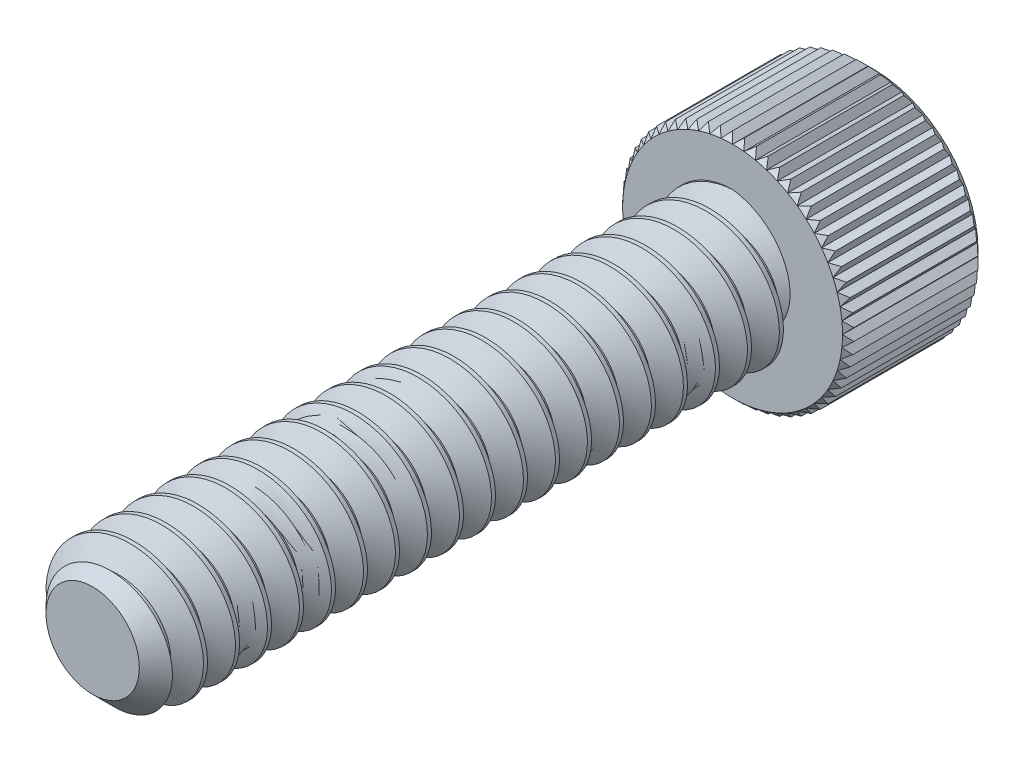
from build123d import *
from build123d.topology import SkipClean

# Parameters (mm, degrees)
SKETCH1_R          = 1.7526
EXTRUDE1_DEPTH     = 15.875
CHAMFER3_SIZE      = 0.5953125
CUT_SWEEP1_PITCH   = 0.79375
SKETCH6_R          = 2.8702
EXTRUDE2_DEPTH     = 3.5052
CUT_EXTRUDE1_DEPTH = 2.08359375
CHAMFER1_SIZE      = 0.28702
CHAMFER2_SIZE      = 0.14351
CUT_EXTRUDE3_DEPTH = 17.385717081
CIRPATTERN1_COUNT  = 60


with BuildPart() as part:
    # Sketch1 → Extrude1 (new body)
    with BuildSketch(Plane.XY):
        Circle(SKETCH1_R)
    extrude(amount=-EXTRUDE1_DEPTH)

    # Chamfer3
    chamfer3_edges = [part.edges().sort_by_distance(p)[0] for p in [
        (-1.7526, 0, 0),
    ]]
    chamfer(chamfer3_edges, length=CHAMFER3_SIZE)

    # Cut-Sweep1: the profile of Sketch3 profile screwed along a right-hand helix of 21 turns, 6 arcs to a turn; built about Z, then put on its axis
    cut_sweep1_z = Axis((0, 0, 0), (0, 0, 1))
    cut_sweep1_corners = [(1.7529, 0, -0.694704455), (1.237044252, 0, -0.396875), (1.237044252, 0, -0.29765625), (1.7529, 0, 0.000173205)]
    with BuildLine(mode=Mode.PRIVATE) as cut_sweep1_profile:
        Line(cut_sweep1_corners[0], cut_sweep1_corners[1])
        Line(cut_sweep1_corners[1], cut_sweep1_corners[2])
        Line(cut_sweep1_corners[2], cut_sweep1_corners[3])
        Line(cut_sweep1_corners[3], cut_sweep1_corners[0])
    cut_sweep1_cap = Face(cut_sweep1_profile.wire())
    cut_sweep1_turn_angles = [0, 30, 60, 90, 120, 150, 180, 210, 240, 270, 300, 330, 360]
    cut_sweep1_turn_weights = [1, 0.8660254037844387, 1, 0.8660254037844387, 1, 0.8660254037844387, 1, 0.8660254037844387, 1, 0.8660254037844387, 1, 0.8660254037844387, 1]
    cut_sweep1_turn_rails = [Edge.make_bspline([Vector(p[0], p[1], 0).rotate(cut_sweep1_z, cut_sweep1_turn_angles[k]) / cut_sweep1_turn_weights[k] + Vector(0, 0, p[2] + CUT_SWEEP1_PITCH * cut_sweep1_turn_angles[k] / 360) for k in range(13)], [0, 0, 0, 1, 1, 2, 2, 3, 3, 4, 4, 5, 5, 6, 6, 6], 2, cut_sweep1_turn_weights) for p in cut_sweep1_corners]
    cut_sweep1_turn_sides = [Face.make_surface_from_curves(cut_sweep1_turn_rails[p[0]], cut_sweep1_turn_rails[p[1]]) for p in [(0, 1), (1, 2), (2, 3), (3, 0)]]
    cut_sweep1 = Plane(origin=(0, 0, 0), x_dir=(0, 1, 0), z_dir=(0, 0, -1)) * Solid(Shell([*[p.moved(Location((0, 0, CUT_SWEEP1_PITCH * i))) for i in range(21) for p in cut_sweep1_turn_sides], cut_sweep1_cap, cut_sweep1_cap.rotate(cut_sweep1_z, 7560).moved(Location((0, 0, CUT_SWEEP1_PITCH * 7560 / 360)))]))
    add(cut_sweep1, mode=Mode.SUBTRACT)

    # Sketch6 → Extrude2 (add)
    with BuildSketch(Plane(origin=(0, 0, -15.875), x_dir=(-1, 0, 0), z_dir=(0, 0, -1))):
        Circle(SKETCH6_R)
    extrude(amount=EXTRUDE2_DEPTH)

    # Sketch7 → Cut-Extrude1 (cut)
    with BuildSketch(Plane(origin=(0, 0, -19.3802), x_dir=(-1, 0, 0), z_dir=(0, 0, -1))):
        Polygon((0, 1.603951217), (-1.3890625, 0.801975608), (-1.3890625, -0.801975608), (0, -1.603951217), (1.3890625, -0.801975608), (1.3890625, 0.801975608), align=None)
    extrude(amount=-CUT_EXTRUDE1_DEPTH, mode=Mode.SUBTRACT)

    # Cut-Extrude2 cone 1 section (through the dimple's axis) → Cut-Extrude2 (revolve, cut)
    with BuildSketch(Plane(origin=(0, 0, -19.3802), x_dir=(0, 1, 0), z_dir=(1, 0, 0))):
        Polygon((0, 0), (1.603951217, 0), (0, 1.603951217), align=None)
    revolve(axis=Axis((0, 0, -19.3802), (0, 0, 1)), mode=Mode.SUBTRACT)

    # Chamfer1
    chamfer1_edges = [part.edges().sort_by_distance(p)[0] for p in [
        (2.8702, 0, -19.3802),
    ]]
    chamfer(chamfer1_edges, length=CHAMFER1_SIZE)

    # Chamfer2
    chamfer2_edges = [part.edges().sort_by_distance(p)[0] for p in [
        (2.8702, 0, -15.875),
    ]]
    chamfer(chamfer2_edges, length=CHAMFER2_SIZE)

    # Sketch10 → Cut-Extrude3 (cut, through all)
    with SkipClean():  # the faces are left unmerged after this step: merging them gives an invalid solid
        with BuildSketch(Plane.XY.offset(-15.875)):
            Polygon((-0.308895946, 3.01371), (0, 2.72669), (0.308895946, 3.01371), align=None)
        cut_extrude3 = extrude(amount=-CUT_EXTRUDE3_DEPTH, mode=Mode.SUBTRACT)

    # CirPattern1: Cut-Extrude3 ×60 about axis
    cirpattern1_axis = Axis((0, 0, 0), (0, 0, 1))
    for i in range(1, CIRPATTERN1_COUNT):
        add(cut_extrude3.rotate(cirpattern1_axis, i * 360 / CIRPATTERN1_COUNT), mode=Mode.SUBTRACT)


solid = part.part
